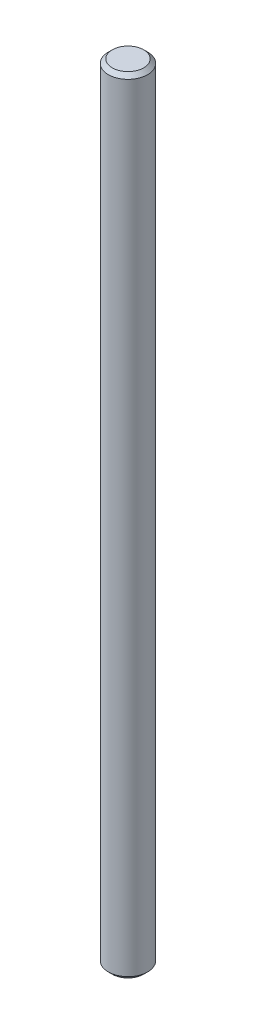
from build123d import *

# Parameters (mm, degrees)
SKETCH2_R           = 2.5
BOSS_EXTRUDE1_DEPTH = 100
CHAMFER1_SIZE       = 0.5


with BuildPart() as part:
    # Sketch2 → Boss-Extrude1 (new body)
    with BuildSketch(Plane(origin=(0, 0, 0), x_dir=(1, 0, 0), z_dir=(0, 1, 0))):
        Circle(SKETCH2_R)
    extrude(amount=BOSS_EXTRUDE1_DEPTH)

    # Chamfer1
    chamfer1_edges = [part.edges().sort_by_distance(p)[0] for p in [
        (-2.5, 0, 0),
        (-2.5, 100, 0),
    ]]
    chamfer(chamfer1_edges, length=CHAMFER1_SIZE)


solid = part.part
